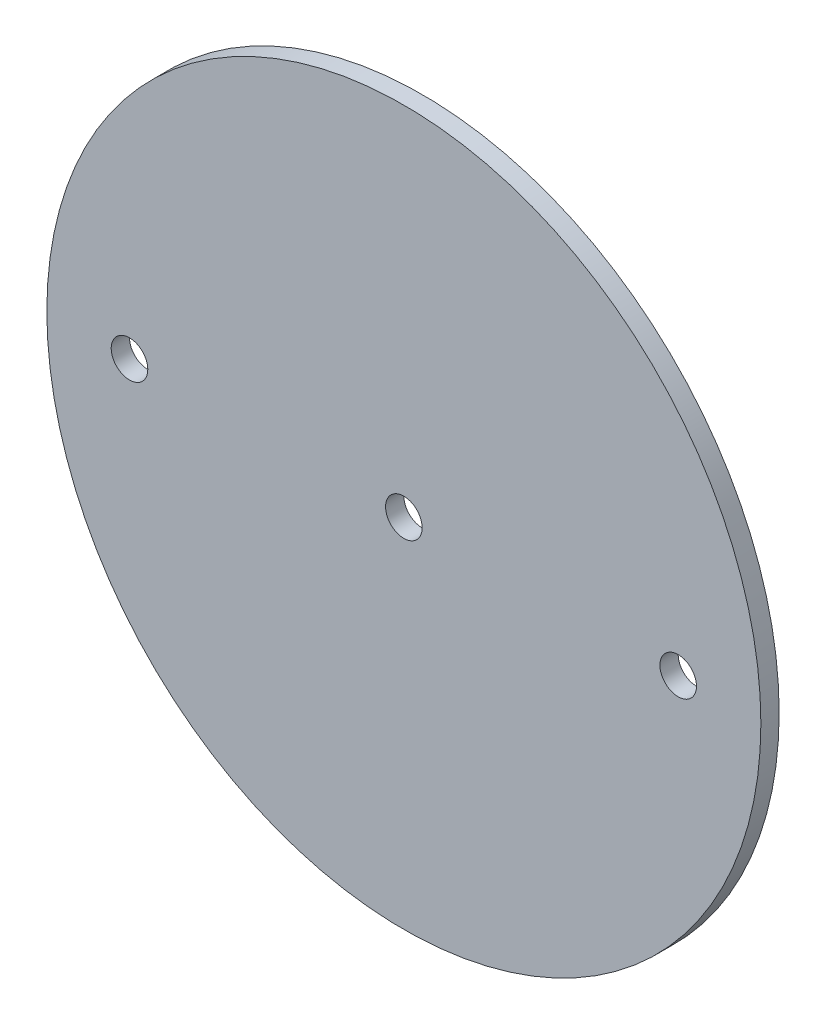
from build123d import *

# Parameters (mm, degrees)
SKETCH1_R                   = 61.976
BOSS_EXTRUDE1_DEPTH         = 1.5875
F_1_4_0_25_DIAMETER_HOLE1_D = 6.35


with BuildPart() as part:
    # Sketch1 → Boss-Extrude1 (new, symmetric)
    with BuildSketch(Plane.XY):
        Circle(SKETCH1_R)
    extrude(amount=BOSS_EXTRUDE1_DEPTH, both=True)

    # 1/4 (0.25) Diameter Hole1 (through all)
    with Locations(Plane.XY.offset(1.5875)):
        with Locations((-47.625, 0), (0, 0), (47.625, 0)):
            Hole(F_1_4_0_25_DIAMETER_HOLE1_D / 2)


solid = part.part
